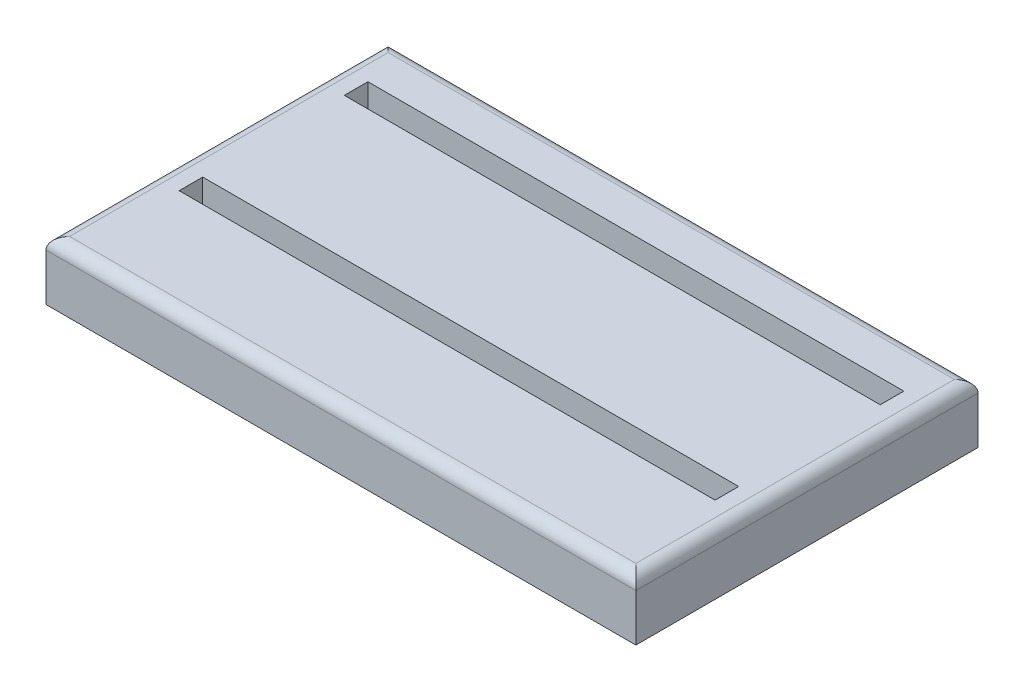
from build123d import *

# Parameters (mm, degrees)
SKETCH2_W           = 127
SKETCH2_H           = 73.66
BOSS_EXTRUDE1_DEPTH = 12.7
FILLET1_R           = 2.54
SKETCH3_W           = 115.38555028
SKETCH3_H           = 5.08
CUT_EXTRUDE1_DEPTH  = 12.7


with BuildPart() as part:
    # Sketch2 → Boss-Extrude1 (new body)
    with BuildSketch(Plane(origin=(0, 0, 0), x_dir=(1, 0, 0), z_dir=(0, 1, 0))):
        with Locations((0, -6.35)):
            Rectangle(SKETCH2_W, SKETCH2_H)
    extrude(amount=BOSS_EXTRUDE1_DEPTH)

    # Fillet1
    fillet1_edges = [part.edges().sort_by_distance(p)[0] for p in [
        (63.5, 12.7, 6.35),
        (-63.5, 12.7, 6.35),
        (0, 12.7, 43.18),
        (0, 12.7, -30.48),
    ]]
    fillet(fillet1_edges, radius=FILLET1_R)

    # Sketch3 → Cut-Extrude1 (cut)
    with BuildSketch(Plane(origin=(0, 12.7, 0), x_dir=(1, 0, 0), z_dir=(0, 1, 0))):
        with Locations((-2.54e-06, 17.78)):
            Rectangle(SKETCH3_W, SKETCH3_H)
        with Locations((-2.54e-06, -17.78)):
            Rectangle(SKETCH3_W, SKETCH3_H)
    extrude(amount=-CUT_EXTRUDE1_DEPTH, mode=Mode.SUBTRACT)


solid = part.part
